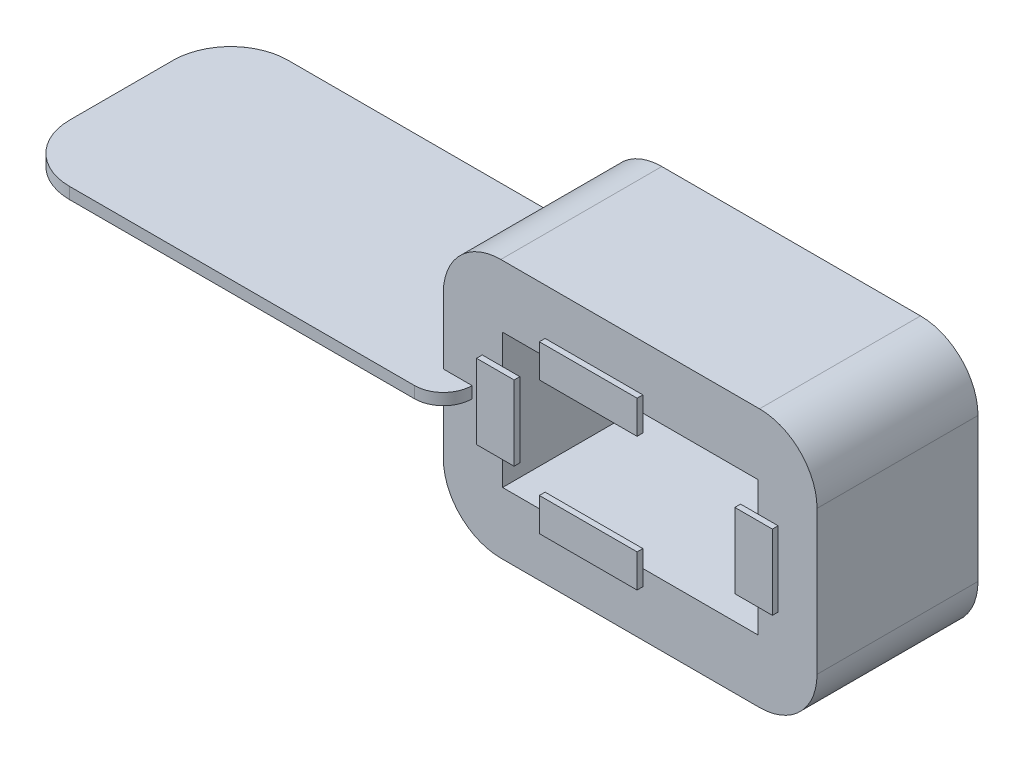
from build123d import *

# Parameters (mm, degrees)
SKETCH_1_W           = 65
SKETCH_1_H           = 45
EXTRUDE_1_DEPTH      = 28
SKETCH_2_W           = 44.4
SKETCH_2_H           = 23.4
CUT_EXTRUDE_1_DEPTH  = 39
FILLET_1_R           = 10
FILLET_2_R           = 10
FILLET_3_R           = 10
FILLET_4_R           = 10
EXTRUDE_6_DEPTH      = 1
EXTRUDE_6_2_DEPTH    = 1
EXTRUDE_6_3_DEPTH    = 1
SKETCH_10_W          = 17
SKETCH_10_H          = 5.754584259
EXTRUDE_6_4_DEPTH    = 1
SKETCH_20_W          = 5.002637397
SKETCH_20_H          = 2
EXTRUDE_7_DEPTH      = 5
SKETCH_21_W          = 5.00232547
SKETCH_21_H          = 2
EXTRUDE_8_DEPTH      = 5
EXTRUDE_9_DEPTH      = 1
EXTRUDE_9_DEPTH_BACK = 1
SKETCH_22_W          = 70
SKETCH_22_H          = 38
FILLET_5_R           = 5
FILLET_6_R           = 5
FILLET_7_R           = 10
FILLET_8_R           = 10


with BuildPart() as part:
    # 草圖1 → 填料-伸長1 (new body)
    with BuildSketch(Plane.XY):
        with Locations((-27.434655272, 0)):
            Rectangle(SKETCH_1_W, SKETCH_1_H)
    extrude(amount=EXTRUDE_1_DEPTH)

    # 草圖2 → 除料-伸長1 (cut)
    with BuildSketch(Plane.XY):
        with Locations((-27.434655272, 0)):
            Rectangle(SKETCH_2_W, SKETCH_2_H)
    extrude(amount=CUT_EXTRUDE_1_DEPTH, mode=Mode.SUBTRACT)

    # 圓角1
    fillet_1_edges = [part.edges().sort_by_distance(p)[0] for p in [
        (-59.934655272, -22.5, 14),
    ]]
    fillet(fillet_1_edges, radius=FILLET_1_R)

    # 圓角2
    fillet_2_edges = [part.edges().sort_by_distance(p)[0] for p in [
        (-59.934655272, 22.5, 14),
    ]]
    fillet(fillet_2_edges, radius=FILLET_2_R)

    # 圓角3
    fillet_3_edges = [part.edges().sort_by_distance(p)[0] for p in [
        (5.065344728, 22.5, 14),
    ]]
    fillet(fillet_3_edges, radius=FILLET_3_R)

    # 圓角4
    fillet_4_edges = [part.edges().sort_by_distance(p)[0] for p in [
        (5.065344728, -22.5, 14),
    ]]
    fillet(fillet_4_edges, radius=FILLET_4_R)

    # 草圖20 → 填料-伸長7 (add)
    with BuildSketch(Plane.XY.offset(28)):
        with Locations((-57.433336574, 0)):
            Rectangle(SKETCH_20_W, SKETCH_20_H)
    extrude(amount=EXTRUDE_7_DEPTH)

    # 草圖21 → 填料-伸長8 (add)
    with BuildSketch(Plane(origin=(0, 0, 0), x_dir=(-1, 0, 0), z_dir=(0, 0, -1))):
        with Locations((57.433492537, 0)):
            Rectangle(SKETCH_21_W, SKETCH_21_H)
    extrude(amount=EXTRUDE_8_DEPTH)

    # 草圖22 → 填料-伸長9 (add, two sides: drawn at the far end of the back side and taken through both)
    with BuildSketch(Plane(origin=(0, 0, 0), x_dir=(1, 0, 0), z_dir=(0, 1, 0)).offset(-EXTRUDE_9_DEPTH_BACK)):
        with Locations((-94.934655272, -14)):
            Rectangle(SKETCH_22_W, SKETCH_22_H)
    extrude(amount=EXTRUDE_9_DEPTH + EXTRUDE_9_DEPTH_BACK)

    # 圓角5
    fillet_5_edges = [part.edges().sort_by_distance(p)[0] for p in [
        (-54.932329802, 0, -5),
    ]]
    fillet(fillet_5_edges, radius=FILLET_5_R - 0.0001)  # a hair under: the kernel refuses the full size

    # 圓角6
    fillet_6_edges = [part.edges().sort_by_distance(p)[0] for p in [
        (-54.932017875, 0, 33),
    ]]
    fillet(fillet_6_edges, radius=FILLET_6_R - 0.0001)  # a hair under: the kernel refuses the full size

    # 圓角7
    fillet_7_edges = [part.edges().sort_by_distance(p)[0] for p in [
        (-129.934655272, 0, -5),
    ]]
    fillet(fillet_7_edges, radius=FILLET_7_R)

    # 圓角8
    fillet_8_edges = [part.edges().sort_by_distance(p)[0] for p in [
        (-129.934655272, 0, 33),
    ]]
    fillet(fillet_8_edges, radius=FILLET_8_R)


with BuildPart() as body_2:
    # 草圖10 → 填料-伸長6 (new body)
    with BuildSketch(Plane.XY.offset(29)):
        Polygon((-49.634655272, 6.5), (-53.165057103, 6.5), (-53.165057103, -6.5), (-46.634655272, -6.5), (-46.634655272, 6.5), align=None)
    extrude(amount=-EXTRUDE_6_DEPTH)


with BuildPart() as body_3:
    # 草圖10 → Extrude 6 2 (new body)
    with BuildSketch(Plane.XY.offset(29)):
        Polygon((-42.234655272, -11.7), (-42.234655272, -8.7), (-25.234655272, -8.7), (-25.234655272, -14.454584259), (-42.234655272, -14.454584259), align=None)
    extrude(amount=-EXTRUDE_6_2_DEPTH)


with BuildPart() as body_4:
    # 草圖10 → Extrude 6 3 (new body)
    with BuildSketch(Plane.XY.offset(29)):
        Polygon((-8.234655272, 6.5), (-8.234655272, -6.5), (-5.234655272, -6.5), (-1.70425344, -6.5), (-1.70425344, 6.5), align=None)
    extrude(amount=-EXTRUDE_6_3_DEPTH)


with BuildPart() as body_5:
    # 草圖10 → Extrude 6 4 (new body)
    with BuildSketch(Plane.XY.offset(29)):
        with Locations((-33.734655272, 11.57729213)):
            Rectangle(SKETCH_10_W, SKETCH_10_H)
    extrude(amount=-EXTRUDE_6_4_DEPTH)


solid = Compound([part.part, body_2.part, body_3.part, body_4.part, body_5.part])
